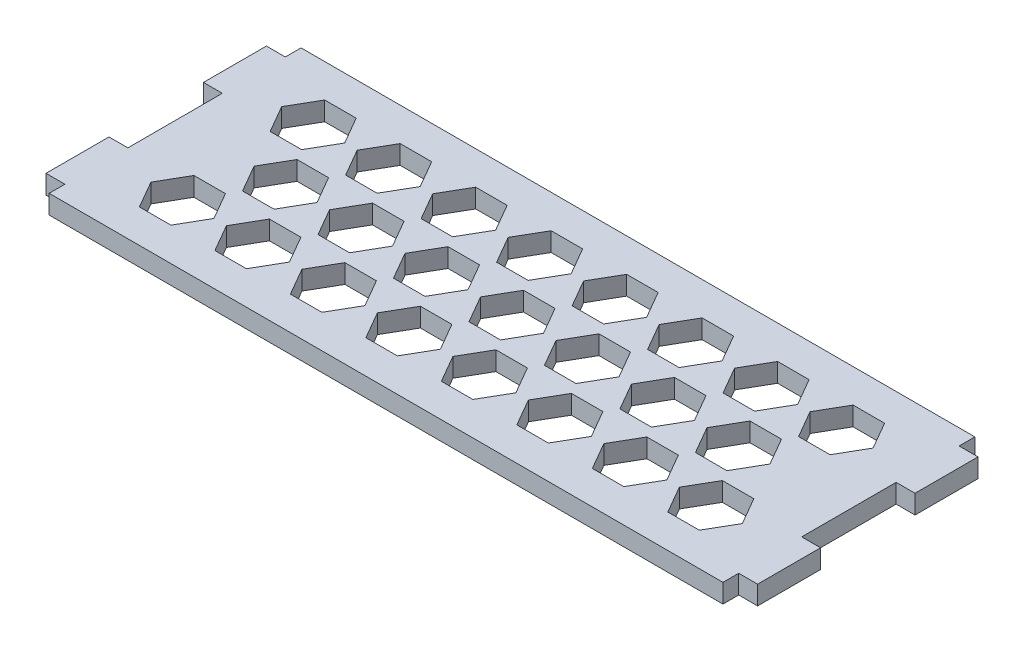
from build123d import *

# Parameters (mm, degrees)
SKETCH1_W           = 214
SKETCH1_H           = 80
BOSS_EXTRUDE1_DEPTH = 6
SKETCH2_W           = 20
SKETCH2_H           = 6
BOSS_EXTRUDE2_DEPTH = 6
FILL_PATTERN1_DEPTH = 6


# Read off the part's stored shape, not the designer's step: Fill Pattern1
with BuildPart() as part:
    # Sketch1 → Boss-Extrude1 (new body)
    with BuildSketch(Plane(origin=(0, 0, 0), x_dir=(1, 0, 0), z_dir=(0, 1, 0))):
        Rectangle(SKETCH1_W, SKETCH1_H)
    extrude(amount=BOSS_EXTRUDE1_DEPTH)

    # Sketch2 → Boss-Extrude2 (add)
    with BuildSketch(Plane(origin=(107, 0, 0), x_dir=(0, 0, -1), z_dir=(1, 0, 0))):
        with Locations((-25, 3)):
            Rectangle(SKETCH2_W, SKETCH2_H)
        with Locations((25, 3)):
            Rectangle(SKETCH2_W, SKETCH2_H)
    boss_extrude2 = extrude(amount=BOSS_EXTRUDE2_DEPTH)

    # Mirror1: Boss-Extrude2 across plane
    add(boss_extrude2.mirror(Plane(origin=(0, 0, 0), x_dir=(0, 0, 1), z_dir=(1, 0, 0))))

    # Fill Pattern1 outline → Fill Pattern1 (cut)
    with BuildSketch(Plane(origin=(0, 0, 0), x_dir=(1, 0, 0), z_dir=(0, 1, 0))):
        Polygon((73.909534619, -20.762225314), (78.909534619, -29.422479352), (88.909534619, -29.422479352), (93.909534619, -20.762225314), (88.909534619, -12.101971276), (78.909534619, -12.101971276), align=None)
        Polygon((61.922458245, 0), (66.922458245, -8.660254038), (76.922458245, -8.660254038), (81.922458245, 0), (76.922458245, 8.660254038), (66.922458245, 8.660254038), align=None)
        Polygon((49.935381871, 20.762225314), (54.935381871, 12.101971276), (64.935381871, 12.101971276), (69.935381871, 20.762225314), (64.935381871, 29.422479352), (54.935381871, 29.422479352), align=None)
        Polygon((-88.909534619, -29.422479352), (-78.909534619, -29.422479352), (-73.909534619, -20.762225314), (-78.909534619, -12.101971276), (-88.909534619, -12.101971276), (-93.909534619, -20.762225314), align=None)
        Polygon((-64.935381871, -29.422479352), (-54.935381871, -29.422479352), (-49.935381871, -20.762225314), (-54.935381871, -12.101971276), (-64.935381871, -12.101971276), (-69.935381871, -20.762225314), align=None)
        Polygon((-40.961229122, -29.422479352), (-30.961229122, -29.422479352), (-25.961229122, -20.762225314), (-30.961229122, -12.101971276), (-40.961229122, -12.101971276), (-45.961229122, -20.762225314), align=None)
        Polygon((-16.987076374, -29.422479352), (-6.987076374, -29.422479352), (-1.987076374, -20.762225314), (-6.987076374, -12.101971276), (-16.987076374, -12.101971276), (-21.987076374, -20.762225314), align=None)
        Polygon((6.987076374, -29.422479352), (16.987076374, -29.422479352), (21.987076374, -20.762225314), (16.987076374, -12.101971276), (6.987076374, -12.101971276), (1.987076374, -20.762225314), align=None)
        Polygon((30.961229122, -29.422479352), (40.961229122, -29.422479352), (45.961229122, -20.762225314), (40.961229122, -12.101971276), (30.961229122, -12.101971276), (25.961229122, -20.762225314), align=None)
        Polygon((54.935381871, -29.422479352), (64.935381871, -29.422479352), (69.935381871, -20.762225314), (64.935381871, -12.101971276), (54.935381871, -12.101971276), (49.935381871, -20.762225314), align=None)
        Polygon((-66.922458245, -8.660254038), (-61.922458245, 0), (-66.922458245, 8.660254038), (-76.922458245, 8.660254038), (-81.922458245, 0), (-76.922458245, -8.660254038), align=None)
        Polygon((-54.935381871, 12.101971276), (-49.935381871, 20.762225314), (-54.935381871, 29.422479352), (-64.935381871, 29.422479352), (-69.935381871, 20.762225314), (-64.935381871, 12.101971276), align=None)
        Polygon((-93.909534619, 20.762225314), (-88.909534619, 12.101971276), (-78.909534619, 12.101971276), (-73.909534619, 20.762225314), (-78.909534619, 29.422479352), (-88.909534619, 29.422479352), align=None)
        Polygon((-42.948305497, -8.660254038), (-37.948305497, 0), (-42.948305497, 8.660254038), (-52.948305497, 8.660254038), (-57.948305497, 0), (-52.948305497, -8.660254038), align=None)
        Polygon((-30.961229122, 12.101971276), (-25.961229122, 20.762225314), (-30.961229122, 29.422479352), (-40.961229122, 29.422479352), (-45.961229122, 20.762225314), (-40.961229122, 12.101971276), align=None)
        Polygon((-18.974152748, -8.660254038), (-13.974152748, 0), (-18.974152748, 8.660254038), (-28.974152748, 8.660254038), (-33.974152748, 0), (-28.974152748, -8.660254038), align=None)
        Polygon((-6.987076374, 12.101971276), (-1.987076374, 20.762225314), (-6.987076374, 29.422479352), (-16.987076374, 29.422479352), (-21.987076374, 20.762225314), (-16.987076374, 12.101971276), align=None)
        Polygon((5, -8.660254038), (10, 0), (5, 8.660254038), (-5, 8.660254038), (-10, 0), (-5, -8.660254038), align=None)
        Polygon((16.987076374, 12.101971276), (21.987076374, 20.762225314), (16.987076374, 29.422479352), (6.987076374, 29.422479352), (1.987076374, 20.762225314), (6.987076374, 12.101971276), align=None)
        Polygon((28.974152748, -8.660254038), (33.974152748, 0), (28.974152748, 8.660254038), (18.974152748, 8.660254038), (13.974152748, 0), (18.974152748, -8.660254038), align=None)
        Polygon((40.961229122, 12.101971276), (45.961229122, 20.762225314), (40.961229122, 29.422479352), (30.961229122, 29.422479352), (25.961229122, 20.762225314), (30.961229122, 12.101971276), align=None)
        Polygon((52.948305497, -8.660254038), (57.948305497, 0), (52.948305497, 8.660254038), (42.948305497, 8.660254038), (37.948305497, 0), (42.948305497, -8.660254038), align=None)
        Polygon((88.909534619, 12.101971276), (93.909534619, 20.762225314), (88.909534619, 29.422479352), (78.909534619, 29.422479352), (73.909534619, 20.762225314), (78.909534619, 12.101971276), align=None)
    extrude(amount=FILL_PATTERN1_DEPTH, mode=Mode.SUBTRACT)


solid = part.part
